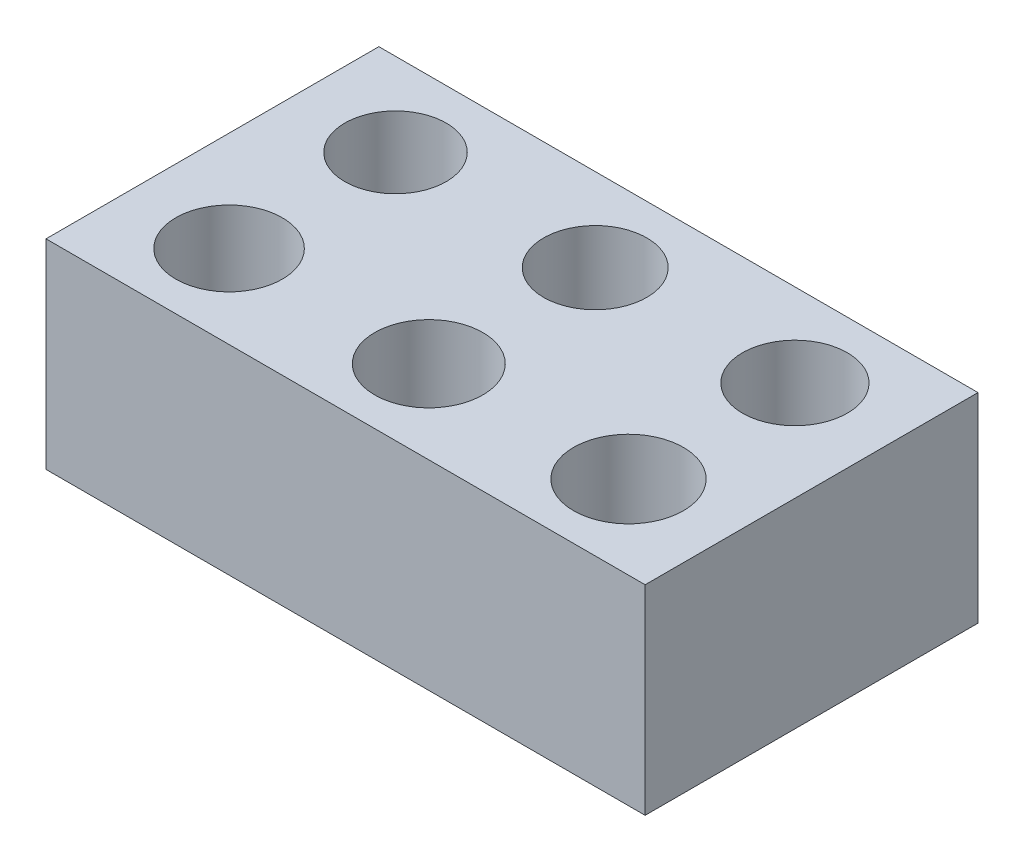
from build123d import *

# Parameters (mm, degrees)
SKETCH1_W           = 18
SKETCH1_H           = 10
BOSS_EXTRUDE1_DEPTH = 6
SKETCH1_3_R         = 1.525
SKETCH1_3_R_2       = 1.55
SKETCH1_3_R_3       = 1.575
SKETCH1_3_R_4       = 1.6
SKETCH1_3_R_5       = 1.625
SKETCH1_3_R_6       = 1.65
CUT_EXTRUDE1_DEPTH  = 4


with BuildPart() as part:
    # Sketch1 → Boss-Extrude1 (new body)
    with BuildSketch(Plane(origin=(0, 0, 0), x_dir=(1, 0, 0), z_dir=(0, 1, 0))):
        Rectangle(SKETCH1_W, SKETCH1_H)
    extrude(amount=-BOSS_EXTRUDE1_DEPTH)

    # Sketch1<3> → Cut-Extrude1 (cut)
    with BuildSketch(Plane(origin=(0, 0, 0), x_dir=(1, 0, 0), z_dir=(0, 1, 0))):
        with Locations((-6, 2.5)):
            Circle(SKETCH1_3_R)
        with Locations((0, 2.5)):
            Circle(SKETCH1_3_R_2)
        with Locations((6, 2.5)):
            Circle(SKETCH1_3_R_3)
        with Locations((-6, -2.5)):
            Circle(SKETCH1_3_R_4)
        with Locations((0, -2.5)):
            Circle(SKETCH1_3_R_5)
        with Locations((6, -2.5)):
            Circle(SKETCH1_3_R_6)
    extrude(amount=-CUT_EXTRUDE1_DEPTH, mode=Mode.SUBTRACT)


solid = part.part
